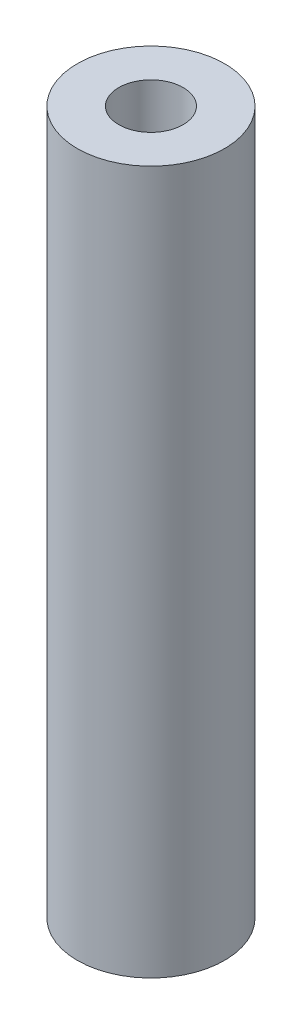
from build123d import *

# Parameters (mm, degrees)
SKETCH_1_R      = 4
SKETCH_1_R_2    = 1.75
EXTRUDE_1_DEPTH = 38.2


with BuildPart() as part:
    # 草图1 → 凸台-拉伸1 (new body)
    with BuildSketch(Plane(origin=(0, 0, 0), x_dir=(1, 0, 0), z_dir=(0, 1, 0))):
        Circle(SKETCH_1_R)
        Circle(SKETCH_1_R_2, mode=Mode.SUBTRACT)
    extrude(amount=EXTRUDE_1_DEPTH)


solid = part.part
